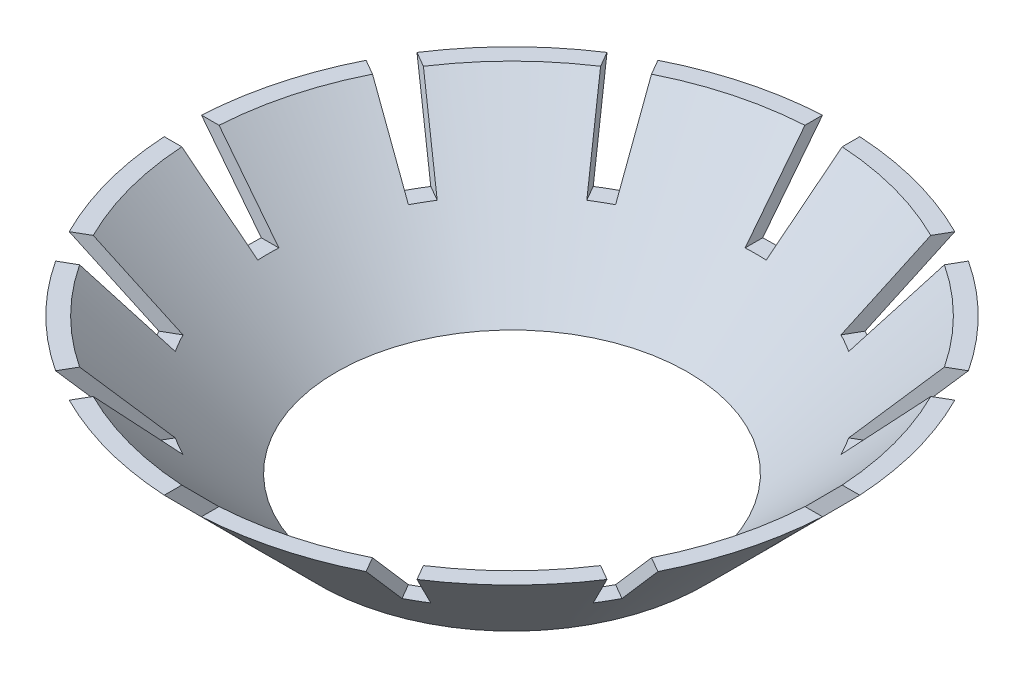
from build123d import *

# Parameters (mm, degrees)
CUT_EXTRUDE1_DEPTH = 24.500448921
CIRPATTERN1_COUNT  = 12


with BuildPart() as part:
    # Sketch1 → Base-Revolve (revolve)
    with BuildSketch(Plane(origin=(0, 0, 0), x_dir=(0, 0, -1), z_dir=(1, 0, 0))):
        Polygon((8.5, 0), (15.1, 6.6), (15.948528137, 6.6), (9.348528137, 0), align=None)
    revolve(axis=Axis((0, -30, 0), (0, 1, 0)))

    # Sketch2 → Cut-Extrude1 (cut, through all)
    with BuildSketch(Plane.XY):
        Polygon((-0.51, 3.3), (0.51, 3.3), (1.02, 7.6), (-1.02, 7.6), align=None)
    cut_extrude1 = extrude(amount=-CUT_EXTRUDE1_DEPTH, mode=Mode.SUBTRACT)

    # CirPattern1: Cut-Extrude1 ×12 about axis
    cirpattern1_axis = Axis((0, -30, 0), (0, 1, 0))
    for i in range(1, CIRPATTERN1_COUNT):
        add(cut_extrude1.rotate(cirpattern1_axis, i * 360 / CIRPATTERN1_COUNT), mode=Mode.SUBTRACT)


solid = part.part
